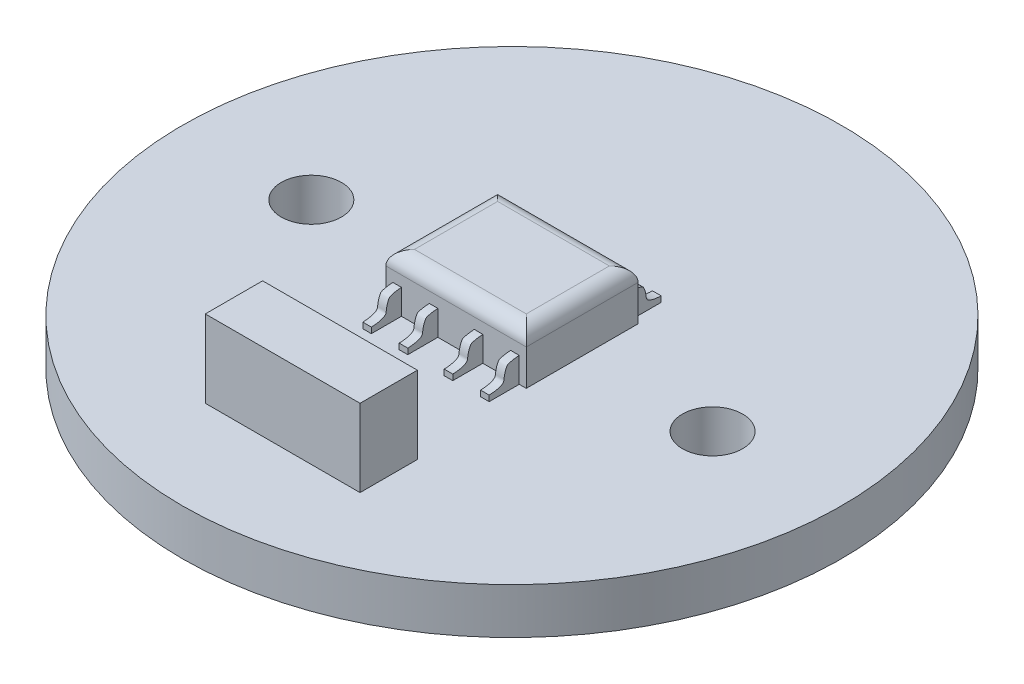
from build123d import *

# Parameters (mm, degrees)
SKETCH1_R               = 11.5
SKETCH1_R_2             = 1.05
BOSS_EXTRUDE1_DEPTH     = 1.6
SKETCH2_W               = 4.9
SKETCH2_H               = 3.9
BOSS_EXTRUDE2_DEPTH     = 1.75
SKETCH3_W               = 0.3
SKETCH3_H               = 1.05
BOSS_EXTRUDE3_DEPTH     = 0.875
MIRROR2_COPY_1_SKETCH_W = 0.3
MIRROR2_COPY_1_SKETCH_H = 1.05
MIRROR2_COPY_1_DEPTH    = 0.875
MIRROR2_COPY_2_SKETCH_W = 0.3
MIRROR2_COPY_2_SKETCH_H = 1.05
MIRROR2_COPY_2_DEPTH    = 0.875
FILLET1_R               = 0.5
CUT_EXTRUDE1_DEPTH      = 19.201635229
SKETCH5_W               = 5.4
SKETCH5_H               = 2
BOSS_EXTRUDE4_DEPTH     = 2.7


with BuildPart() as part:
    # Sketch1 → Boss-Extrude1 (new body)
    with BuildSketch(Plane(origin=(0, 0, 0), x_dir=(1, 0, 0), z_dir=(0, 1, 0))):
        Circle(SKETCH1_R)
        with Locations((-7, 0)):
            Circle(SKETCH1_R_2, mode=Mode.SUBTRACT)
        with Locations((7, 0)):
            Circle(SKETCH1_R_2, mode=Mode.SUBTRACT)
    extrude(amount=BOSS_EXTRUDE1_DEPTH)

    # Sketch2 → Boss-Extrude2 (add)
    with BuildSketch(Plane(origin=(0, 1.6, 0), x_dir=(1, 0, 0), z_dir=(0, 1, 0))):
        Rectangle(SKETCH2_W, SKETCH2_H)
    extrude(amount=BOSS_EXTRUDE2_DEPTH)

    # Sketch3 → Boss-Extrude3 (add)
    with BuildSketch(Plane(origin=(0, 1.6, 0), x_dir=(1, 0, 0), z_dir=(0, 1, 0))):
        with Locations((-2.055, -2.475)):
            Rectangle(SKETCH3_W, SKETCH3_H)
        with Locations((-0.785, -2.475)):
            Rectangle(SKETCH3_W, SKETCH3_H)
    boss_extrude3 = extrude(amount=BOSS_EXTRUDE3_DEPTH)

    # Mirror1: Boss-Extrude3 across plane
    add(boss_extrude3.mirror(Plane(origin=(0, 0, 0), x_dir=(0, 0, 1), z_dir=(1, 0, 0))))

    # Mirror2 copy 1 sketch → Mirror2 copy 1 (add)
    with BuildSketch(Plane(origin=(0, 1.6, 0), x_dir=(-1, 0, 0), z_dir=(0, 1, 0))):
        with Locations((-2.055, -2.475)):
            Rectangle(MIRROR2_COPY_1_SKETCH_W, MIRROR2_COPY_1_SKETCH_H)
        with Locations((-0.785, -2.475)):
            Rectangle(MIRROR2_COPY_1_SKETCH_W, MIRROR2_COPY_1_SKETCH_H)
    extrude(amount=MIRROR2_COPY_1_DEPTH)

    # Mirror2 copy 2 sketch → Mirror2 copy 2 (add)
    with BuildSketch(Plane(origin=(0, 1.6, 0), x_dir=(1, 0, 0), z_dir=(0, 1, 0))):
        with Locations((-2.055, 2.475)):
            Rectangle(MIRROR2_COPY_2_SKETCH_W, MIRROR2_COPY_2_SKETCH_H)
        with Locations((-0.785, 2.475)):
            Rectangle(MIRROR2_COPY_2_SKETCH_W, MIRROR2_COPY_2_SKETCH_H)
    extrude(amount=MIRROR2_COPY_2_DEPTH)

    # Fillet1
    fillet1_edges = [part.edges().sort_by_distance(p)[0] for p in [
        (0, 3.35, 1.95),
        (-2.45, 3.35, 0),
        (0, 3.35, -1.95),
        (2.45, 3.35, 0),
    ]]
    fillet(fillet1_edges, radius=FILLET1_R)

    # Sketch4 → Cut-Extrude1 (cut, symmetric)
    with BuildSketch(Plane(origin=(2.205, 0, 0), x_dir=(0, 0, -1), z_dir=(1, 0, 0))):
        with BuildLine():
            Line((1.95, 2.475), (3, 2.475))
            Line((3, 2.475), (3, 1.8))
            add(Edge.make_bspline(
                [(1.95, 2.475), (2.11282764, 2.469119828), (2.355374015, 2.418848487), (2.406128477, 2.315792307), (2.472012078, 2.177966716), (2.490807891, 1.870806769), (2.800865545, 1.800605138), (3, 1.8)],
                knots=[0, 0, 0, 0, 0.320657498, 0.400502937, 0.754237561, 0.81860895, 1, 1, 1, 1], degree=3))
        make_face()
    cut_extrude1 = extrude(amount=CUT_EXTRUDE1_DEPTH, both=True, mode=Mode.SUBTRACT)

    # Mirror3: Cut-Extrude1 across plane
    add(cut_extrude1.mirror(Plane.XY), mode=Mode.SUBTRACT)

    # Sketch5 → Boss-Extrude4 (add)
    with BuildSketch(Plane(origin=(0, 1.6, 0), x_dir=(1, 0, 0), z_dir=(0, 1, 0))):
        with Locations((0, -7)):
            Rectangle(SKETCH5_W, SKETCH5_H)
    extrude(amount=BOSS_EXTRUDE4_DEPTH)


solid = part.part
